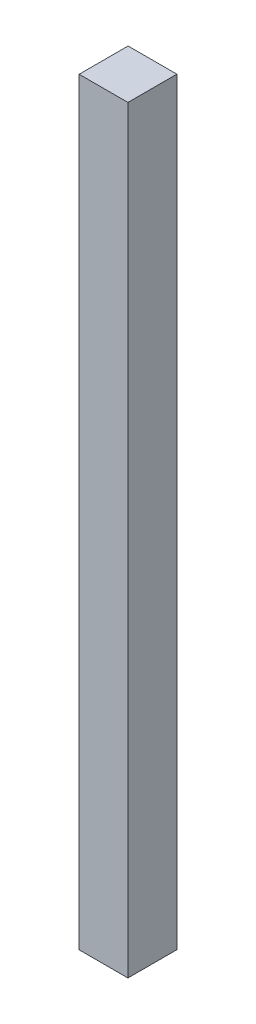
from build123d import *

# Parameters (mm, degrees)
SKETCH1_W           = 34.798
SKETCH1_H           = 34.925
BOSS_EXTRUDE1_DEPTH = 541.02


with BuildPart() as part:
    # Sketch1 → Boss-Extrude1 (new body)
    with BuildSketch(Plane(origin=(0, 0, 0), x_dir=(1, 0, 0), z_dir=(0, 1, 0))):
        Rectangle(SKETCH1_W, SKETCH1_H)
    extrude(amount=BOSS_EXTRUDE1_DEPTH)


solid = part.part
